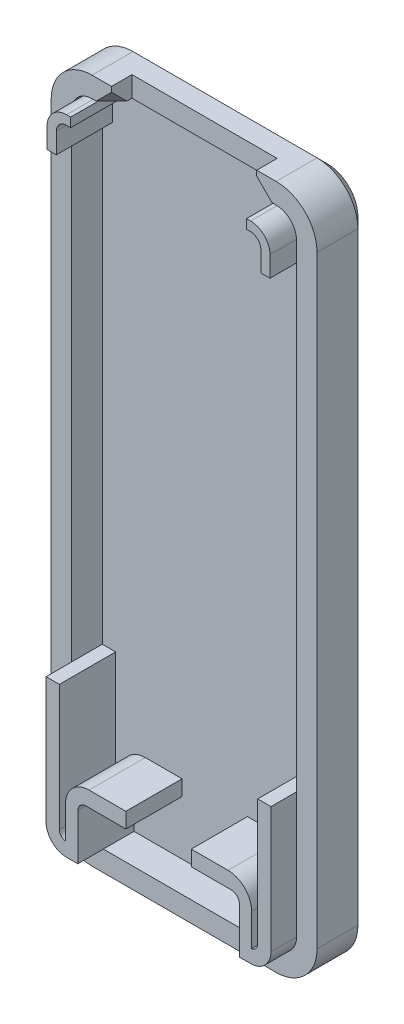
from build123d import *

# Parameters (mm, degrees)
BOSS_EXTRUDE1_DEPTH = 2
BOSS_EXTRUDE2_DEPTH = 5.5
BOSS_EXTRUDE3_DEPTH = 3
SKETCH5_W           = 14.2
SKETCH5_H           = 2
CUT_EXTRUDE1_DEPTH  = 3
CHAMFER1_SIZE       = 1
CHAMFER2_START      = 154
CHAMFER2_DEPTH      = 1.803469575
CHAMFER3_START      = -11.465845015
CHAMFER3_DEPTH      = 10.161362536


with BuildPart() as part:
    # Sketch1 → Boss-Extrude1 (new body)
    with BuildSketch(Plane.XY):
        with BuildLine():
            Line((116.000053406, 143.259475708), (134.000045776, 143.259475708))
            ThreePointArc((134.000045776, 143.259475708), (136.828472901, 142.087902833), (138.000045776, 139.259475708))
            Line((138.000045776, 139.259475708), (138.000045776, 80.259468079))
            ThreePointArc((138.000045776, 80.259468079), (136.828472901, 77.431040954), (134.000045776, 76.259468079))
            Line((134.000045776, 76.259468079), (116.000053406, 76.259468079))
            ThreePointArc((116.000053406, 76.259468079), (113.171626281, 77.431040954), (112.000053406, 80.259468079))
            Line((112.000053406, 80.259468079), (112.000053406, 139.259475708))
            ThreePointArc((112.000053406, 139.259475708), (113.171626281, 142.087902833), (116.000053406, 143.259475708))
        make_face()
    extrude(amount=BOSS_EXTRUDE1_DEPTH)

    # Sketch2 → Boss-Extrude2 (add)
    with BuildSketch(Plane.XY.offset(2)):
        with BuildLine():
            Line((133.600045776, 140.259475708), (134.000045776, 140.259475708))
            ThreePointArc((134.000045776, 140.259475708), (134.707152558, 139.966582489), (135.000045776, 139.259475708))
            Line((135.000045776, 139.259475708), (135.000045776, 137.259475708))
            Line((135.000045776, 137.259475708), (135.900054932, 137.259475708))
            Line((135.900054932, 137.259475708), (135.900054932, 139.259475708))
            ThreePointArc((135.900054932, 139.259475708), (135.343555134, 140.602985066), (134.000045776, 141.159484863))
            Line((134.000045776, 141.159484863), (133.600045776, 141.159484863))
            Line((133.600045776, 141.159484863), (133.600045776, 140.259475708))
        make_face()
        with BuildLine():
            Line((114.10005188, 137.259475708), (115.000053406, 137.259475708))
            Line((115.000053406, 137.259475708), (115.000053406, 139.259475708))
            ThreePointArc((115.000053406, 139.259475708), (115.292946625, 139.966582489), (116.000053406, 140.259475708))
            Line((116.000053406, 140.259475708), (116.400053406, 140.259475708))
            Line((116.400053406, 140.259475708), (116.400053406, 141.159469604))
            Line((116.400053406, 141.159469604), (116.000053406, 141.159469604))
            ThreePointArc((116.000053406, 141.159469604), (114.656549443, 140.602972042), (114.10005188, 139.259468079))
            Line((114.10005188, 139.259468079), (114.10005188, 137.259475708))
        make_face()
        with BuildLine():
            Line((115.300053406, 92.559468079), (114.000048828, 92.559468079))
            Line((114.000048828, 92.559468079), (114.000048828, 80.259475708))
            ThreePointArc((114.000048828, 80.259475708), (114.585836607, 78.845258909), (116.000053406, 78.25947113))
            Line((116.000053406, 78.25947113), (117.100048828, 78.25947113))
            Line((117.100048828, 78.25947113), (117.100048828, 82.759475708))
            ThreePointArc((117.100048828, 82.759475708), (117.334362956, 83.325160054), (117.900047302, 83.559474182))
            Line((117.900047302, 83.559474182), (121.800053406, 83.559474182))
            Line((121.800053406, 83.559474182), (121.800053406, 85.059468079))
            Line((121.800053406, 85.059468079), (118.200050354, 85.059468079))
            ThreePointArc((118.200050354, 85.059468079), (116.573704757, 84.385813675), (115.900050354, 82.759468079))
            Line((115.900050354, 82.759468079), (115.900050354, 79.566648196))
            ThreePointArc((115.900050354, 79.566648196), (115.470902134, 79.801211675), (115.300053406, 80.259468079))
            Line((115.300053406, 80.259468079), (115.300053406, 92.559468079))
        make_face()
        with BuildLine():
            Line((128.200045776, 85.059468079), (128.200045776, 83.559458923))
            Line((128.200045776, 83.559458923), (132.10005188, 83.559458923))
            ThreePointArc((132.10005188, 83.559458923), (132.665730831, 83.32514703), (132.900042725, 82.759468079))
            Line((132.900042725, 82.759468079), (132.900042725, 78.25947113))
            Line((132.900042725, 78.25947113), (134.000045776, 78.25947113))
            ThreePointArc((134.000045776, 78.25947113), (135.414257181, 78.845256674), (136.000042725, 80.259468079))
            Line((136.000042725, 80.259468079), (136.000042725, 92.559468079))
            Line((136.000042725, 92.559468079), (134.700045776, 92.559468079))
            Line((134.700045776, 92.559468079), (134.700045776, 80.259468079))
            ThreePointArc((134.700045776, 80.259468079), (134.529197048, 79.801211675), (134.100048828, 79.566648196))
            Line((134.100048828, 79.566648196), (134.100048828, 82.759468079))
            ThreePointArc((134.100048828, 82.759468079), (133.426394425, 84.385813675), (131.800048828, 85.059468079))
            Line((131.800048828, 85.059468079), (128.200045776, 85.059468079))
        make_face()
    extrude(amount=BOSS_EXTRUDE2_DEPTH)


with BuildPart() as boss_extrude3_tool:
    # Sketch3 → Boss-Extrude3 (new body)
    with BuildSketch(Plane.XY.offset(2)):
        with BuildLine():
            Line((116.000053406, 76.259468079), (134.000045776, 76.259468079))
            ThreePointArc((134.000045776, 76.259468079), (136.828472901, 77.431040954), (138.000045776, 80.259468079))
            Line((138.000045776, 80.259468079), (138.000045776, 139.259475708))
            ThreePointArc((138.000045776, 139.259475708), (136.828472901, 142.087902833), (134.000045776, 143.259475708))
            Line((134.000045776, 143.259475708), (116.000053406, 143.259475708))
            ThreePointArc((116.000053406, 143.259475708), (113.171626281, 142.087902833), (112.000053406, 139.259475708))
            Line((112.000053406, 139.259475708), (112.000053406, 80.259468079))
            ThreePointArc((112.000053406, 80.259468079), (113.171626281, 77.431040954), (116.000053406, 76.259468079))
        make_face()
        with BuildLine():
            Line((116.000053406, 78.259468079), (134.000045776, 78.259468079))
            ThreePointArc((134.000045776, 78.259468079), (135.414259339, 78.845254516), (136.000045776, 80.259468079))
            Line((136.000045776, 80.259468079), (136.000045776, 139.259475708))
            ThreePointArc((136.000045776, 139.259475708), (135.414259339, 140.67368927), (134.000045776, 141.259475708))
            Line((134.000045776, 141.259475708), (116.000053406, 141.259475708))
            ThreePointArc((116.000053406, 141.259475708), (114.585839843, 140.67368927), (114.000053406, 139.259475708))
            Line((114.000053406, 139.259475708), (114.000053406, 80.259468079))
            ThreePointArc((114.000053406, 80.259468079), (114.585839843, 78.845254516), (116.000053406, 78.259468079))
        make_face(mode=Mode.SUBTRACT)
    extrude(amount=BOSS_EXTRUDE3_DEPTH)


with BuildPart() as part_1:
    add(part.part)


with BuildPart() as part_2:
    # Boss-Extrude3: joined with boss_extrude3_tool
    add(part_1.part.fuse(boss_extrude3_tool.part, tol=0.00001))

    # Sketch5 → Cut-Extrude1 (cut)
    with BuildSketch(Plane(origin=(0, 143.259475708, 0), x_dir=(1, 0, 0), z_dir=(0, 1, 0))):
        with Locations((125.000049591, -4)):
            Rectangle(SKETCH5_W, SKETCH5_H)
    extrude(amount=-CUT_EXTRUDE1_DEPTH, mode=Mode.SUBTRACT)

    # Chamfer1
    chamfer1_edges = [part_2.edges().sort_by_distance(p)[0] for p in [
        (138.000045776, 109.759471893, 0),
        (136.828472901, 77.431040954, 0),
        (125.000049591, 76.259468079, 0),
        (113.171626281, 77.431040954, 0),
        (112.000053406, 109.759471893, 0),
        (113.171626281, 142.087902833, 0),
        (125.000049591, 143.259475708, 0),
        (136.828472901, 142.087902833, 0),
    ]]
    chamfer(chamfer1_edges, length=CHAMFER1_SIZE)

    # Chamfer2: read off the stored shape, not the designer's step
    # Chamfer2 outline → Chamfer2 (cut)
    with BuildSketch(Plane(origin=(0, 0, 0), x_dir=(0.8164965809277274, -0.4082482904638596, 0.4082482904638638), z_dir=(0.5773502691896238, 0.5773502691896238, -0.5773502691896297)).offset(CHAMFER2_START)):
        Polygon((51.619168378, -104.481727258), (53.456285686, -103.421067086), (51.619168378, -102.360406914), align=None)
    extrude(amount=CHAMFER2_DEPTH, mode=Mode.SUBTRACT)

    # Chamfer3: read off the stored shape, not the designer's step
    # Chamfer3 outline → Chamfer3 (cut)
    with BuildSketch(Plane(origin=(0, 0, 0), x_dir=(0.8164965809277249, 0.4082482904638619, -0.4082482904638661), z_dir=(0.5773502691896272, -0.5773502691896221, 0.5773502691896281)).offset(CHAMFER3_START)):
        Polygon((152.505057835, 104.481727258), (150.667940528, 103.421067086), (152.505057835, 102.360406914), align=None)
    extrude(amount=CHAMFER3_DEPTH, mode=Mode.SUBTRACT)


solid = part_2.part
